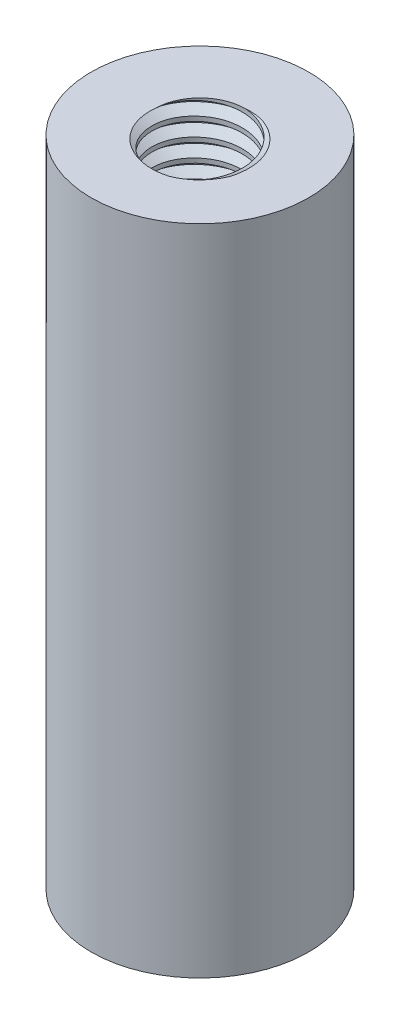
from build123d import *

# Parameters (mm, degrees)
SKETCH1_R           = 3
BOSS_EXTRUDE1_DEPTH = 9
SKETCH2_R           = 1.25
CUT_EXTRUDE1_DEPTH  = 8.5
THREAD1_PITCH       = 0.5


with BuildPart() as part:
    # Sketch1 → Boss-Extrude1 (new body)
    with BuildSketch(Plane(origin=(0, 0, 0), x_dir=(1, 0, 0), z_dir=(0, 1, 0))):
        with Locations(Location((0, 0, 0), (0, 0, 270))):
            Circle(SKETCH1_R)
    extrude(amount=BOSS_EXTRUDE1_DEPTH)

    # Sketch2 → Cut-Extrude1 (cut)
    with BuildSketch(Plane(origin=(0, 9, 0), x_dir=(1, 0, 0), z_dir=(0, 1, 0))):
        with Locations(Location((0, 0, 0), (0, 0, 270))):
            Circle(SKETCH2_R)
    extrude(amount=-CUT_EXTRUDE1_DEPTH, mode=Mode.SUBTRACT)

    # Thread1: the profile of Thread Profile1 profile screwed along a right-hand helix of 20 turns, 6 arcs to a turn; built about Z, then put on its axis
    thread1_z = Axis((0, 0, 0), (0, 0, 1))
    thread1_corners = [(1.2497, 0, -0.000173205), (1.520632938, 0, 0.156249999), (1.520632937, 0, 0.218749999), (1.2497, 0, 0.375173204)]
    with BuildLine(mode=Mode.PRIVATE) as thread1_profile:
        Line(thread1_corners[0], thread1_corners[1])
        Line(thread1_corners[1], thread1_corners[2])
        Line(thread1_corners[2], thread1_corners[3])
        Line(thread1_corners[3], thread1_corners[0])
    thread1_cap = Face(thread1_profile.wire())
    thread1_turn_angles = [0, 30, 60, 90, 120, 150, 180, 210, 240, 270, 300, 330, 360]
    thread1_turn_weights = [1, 0.8660254037844387, 1, 0.8660254037844387, 1, 0.8660254037844387, 1, 0.8660254037844387, 1, 0.8660254037844387, 1, 0.8660254037844387, 1]
    thread1_turn_rails = [Edge.make_bspline([Vector(p[0], p[1], 0).rotate(thread1_z, thread1_turn_angles[k]) / thread1_turn_weights[k] + Vector(0, 0, p[2] + THREAD1_PITCH * thread1_turn_angles[k] / 360) for k in range(13)], [0, 0, 0, 1, 1, 2, 2, 3, 3, 4, 4, 5, 5, 6, 6, 6], 2, thread1_turn_weights) for p in thread1_corners]
    thread1_turn_sides = [Face.make_surface_from_curves(thread1_turn_rails[p[0]], thread1_turn_rails[p[1]]) for p in [(0, 1), (1, 2), (2, 3), (3, 0)]]
    thread1 = Plane(origin=(0, 11, 0), x_dir=(-1, 0, 0), z_dir=(0, -1, 0)) * Solid(Shell([*[p.moved(Location((0, 0, THREAD1_PITCH * i))) for i in range(20) for p in thread1_turn_sides], thread1_cap, thread1_cap.rotate(thread1_z, 7200).moved(Location((0, 0, THREAD1_PITCH * 7200 / 360)))]))
    add(thread1, mode=Mode.SUBTRACT)

    # Mirror1: part across plane


with BuildPart() as part_1:
    add(part.part)
    add(part.part.mirror(Plane.ZX))


solid = part_1.part
